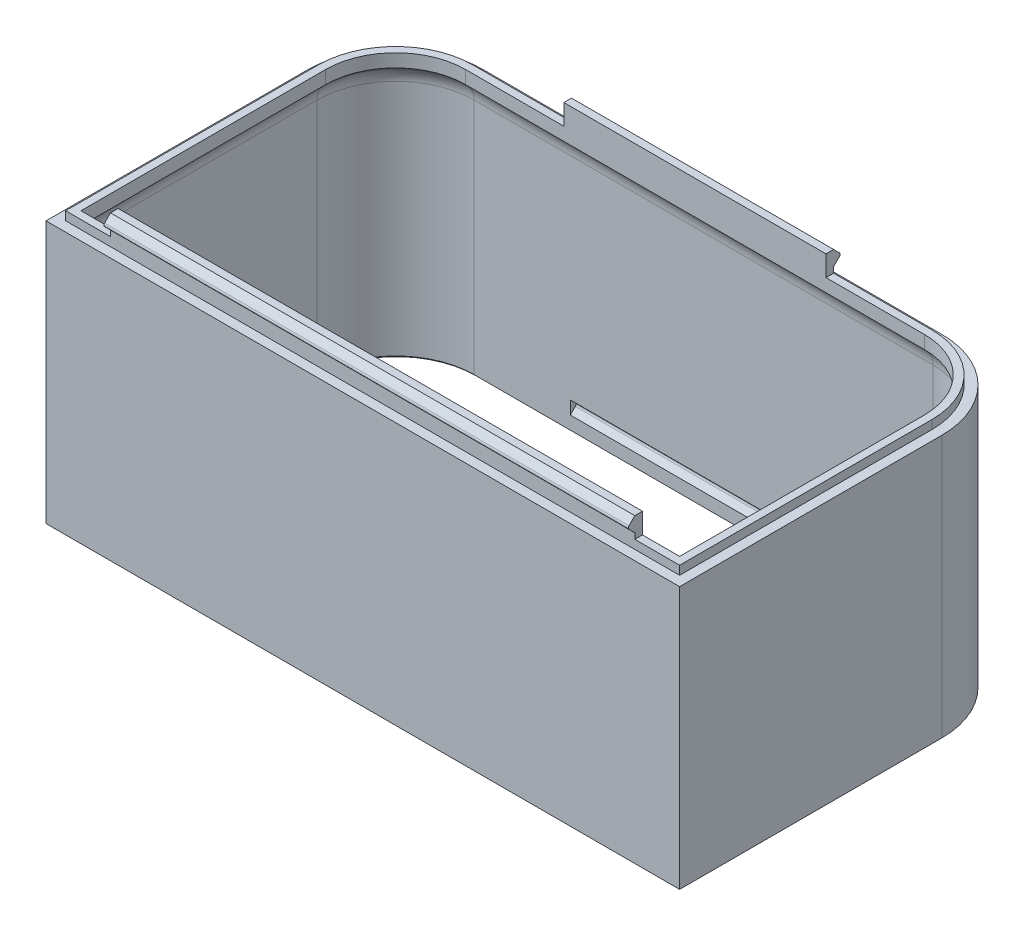
from build123d import *

# Parameters (mm, degrees)
EXTRUDE_1_DEPTH     = 60
EXTRUDE_START       = -1
EXTRUDE_2_DEPTH     = 1
CHAMFER_3_SIZE      = 2
EXTRUDE_8_DEPTH     = 2
EXTRUDE_9_DEPTH     = 30
EXTRUDE_10_DEPTH    = 60
CUT_EXTRUDE_2_DEPTH = 60.5
CUT_EXTRUDE_3_DEPTH = 30.5
CHAMFER_6_SIZE      = 0.5
FILLET_3_R          = 5
FILLET_4_R          = 0.5
FILLET_5_R          = 0.5


with BuildPart() as part:
    # Эскиз1 → Бобышка-Вытянуть1 (new body)
    with BuildSketch(Plane(origin=(0, 0, 0), x_dir=(1, 0, 0), z_dir=(0, 1, 0))):
        with BuildLine():
            Line((-72.5, 0), (72.5, 0))
            Line((72.5, 0), (72.5, 60))
            ThreePointArc((72.5, 60), (66.642135624, 74.142135624), (52.5, 80))
            Line((52.5, 80), (-52.5, 80))
            ThreePointArc((-52.5, 80), (-66.642135624, 74.142135624), (-72.5, 60))
            Line((-72.5, 60), (-72.5, 0))
        make_face()
        with BuildLine():
            Line((-70.5, 2), (70.5, 2))
            Line((70.5, 2), (70.5, 60))
            ThreePointArc((70.5, 60), (65.227922061, 72.727922061), (52.5, 78))
            Line((52.5, 78), (-52.5, 78))
            ThreePointArc((-52.5, 78), (-65.227922061, 72.727922061), (-70.5, 60))
            Line((-70.5, 60), (-70.5, 2))
        make_face(mode=Mode.SUBTRACT)
    extrude(amount=EXTRUDE_1_DEPTH)

    # Эскиз2 → Бобышка-Вытянуть2 (add)
    with BuildSketch(Plane(origin=(0, 60, 0), x_dir=(1, 0, 0), z_dir=(0, 1, 0)).offset(EXTRUDE_START)):
        with BuildLine():
            Line((-72.5, 60), (-72.5, 0))
            Line((-72.5, 0), (72.5, 0))
            Line((72.5, 0), (72.5, 60))
            ThreePointArc((72.5, 60), (66.642135624, 74.142135624), (52.5, 80))
            Line((52.5, 80), (-52.5, 80))
            ThreePointArc((-52.5, 80), (-66.642135624, 74.142135624), (-72.5, 60))
        make_face()
        with BuildLine():
            Line((-68.5, 60), (-68.5, 4))
            Line((-68.5, 4), (68.5, 4))
            Line((68.5, 4), (68.5, 60))
            ThreePointArc((68.5, 60), (63.813708499, 71.313708499), (52.5, 76))
            Line((52.5, 76), (-52.5, 76))
            ThreePointArc((-52.5, 76), (-63.813708499, 71.313708499), (-68.5, 60))
        make_face(mode=Mode.SUBTRACT)
    extrude(amount=EXTRUDE_2_DEPTH)

    # Фаска3
    chamfer_3_edges = [part.edges().sort_by_distance(p)[0] for p in [
        (-65.227922061, 59, -72.727922061),
        (-70.5, 59, -31),
        (0, 59, -2),
        (70.5, 59, -31),
        (65.227922061, 59, -72.727922061),
        (0, 59, -78),
    ]]
    chamfer(chamfer_3_edges, length=CHAMFER_3_SIZE - 0.0001)  # a hair under: the kernel refuses the full size

    # Эскиз11 → Бобышка-Вытянуть8 (add)
    with BuildSketch(Plane(origin=(0, 60, 0), x_dir=(1, 0, 0), z_dir=(0, 1, 0))):
        with BuildLine():
            Line((70.25, 2.25), (70.25, 60))
            ThreePointArc((70.25, 60), (65.051145366, 72.551145366), (52.5, 77.75))
            Line((52.5, 77.75), (-52.5, 77.75))
            ThreePointArc((-52.5, 77.75), (-65.051145366, 72.551145366), (-70.25, 60))
            Line((-70.25, 60), (-70.25, 2.25))
            Line((-70.25, 2.25), (70.25, 2.25))
        make_face()
        with BuildLine():
            Line((68.5, 4), (68.5, 60))
            ThreePointArc((68.5, 60), (63.813708499, 71.313708499), (52.5, 76))
            Line((52.5, 76), (-52.5, 76))
            ThreePointArc((-52.5, 76), (-63.813708499, 71.313708499), (-68.5, 60))
            Line((-68.5, 60), (-68.5, 4))
            Line((-68.5, 4), (68.5, 4))
        make_face(mode=Mode.SUBTRACT)
    extrude(amount=EXTRUDE_8_DEPTH)

    # Эскиз12 → Бобышка-Вытянуть9 (add, symmetric)
    with BuildSketch(Plane(origin=(0, 0, 0), x_dir=(0, 0, -1), z_dir=(1, 0, 0))):
        Polygon((76, 62), (76, 66.7), (77.75, 66.7), (79.45, 65), (77.75, 63.3), (77.75, 62), align=None)
    extrude(amount=EXTRUDE_9_DEPTH, both=True)

    # Эскиз13 → Бобышка-Вытянуть10 (add, symmetric)
    with BuildSketch(Plane(origin=(0, 0, 0), x_dir=(0, 0, -1), z_dir=(1, 0, 0))):
        Polygon((2.25, 62), (2.25, 63.3), (0.55, 65), (2.25, 66.7), (4, 66.7), (4, 62), align=None)
    extrude(amount=EXTRUDE_10_DEPTH, both=True)

    # Эскиз15 → Вырез-Вытянуть2 (cut, symmetric)
    with BuildSketch(Plane(origin=(0, 0, 0), x_dir=(0, 0, -1), z_dir=(1, 0, 0))):
        Polygon((2, 3.5), (2, 6.5), (0.5, 5), align=None)
    extrude(amount=CUT_EXTRUDE_2_DEPTH, both=True, mode=Mode.SUBTRACT)

    # Эскиз16 → Вырез-Вытянуть3 (cut, symmetric)
    with BuildSketch(Plane(origin=(0, 0, 0), x_dir=(0, 0, -1), z_dir=(1, 0, 0))):
        Polygon((78, 3.5), (78, 6.5), (79.5, 5), align=None)
    extrude(amount=CUT_EXTRUDE_3_DEPTH, both=True, mode=Mode.SUBTRACT)

    # Фаска6
    chamfer_6_edges = [part.edges().sort_by_distance(p)[0] for p in [
        (-70.5, 0, -31),
        (0, 0, -2),
        (70.5, 0, -31),
        (65.227922061, 0, -72.727922061),
        (0, 0, -78),
        (-65.227922061, 0, -72.727922061),
    ]]
    chamfer(chamfer_6_edges, length=CHAMFER_6_SIZE)

    # Скругление3
    fillet_3_edges = [part.edges().sort_by_distance(p)[0] for p in [
        (70.5, 57.0001, -31),
        (65.227922061, 57.0001, -72.727922061),
        (0, 57.0001, -78),
        (-65.227922061, 57.0001, -72.727922061),
        (0, 57.0001, -2),
        (-70.5, 57.0001, -31),
    ]]
    fillet(fillet_3_edges, radius=FILLET_3_R)

    # Скругление4
    fillet_4_edges = [part.edges().sort_by_distance(p)[0] for p in [
        (0, 5, -0.5),
        (0, 5, -79.5),
    ]]
    fillet(fillet_4_edges, radius=FILLET_4_R)

    # Скругление5
    fillet_5_edges = [part.edges().sort_by_distance(p)[0] for p in [
        (0, 65, -79.45),
        (0, 65, -0.55),
    ]]
    fillet(fillet_5_edges, radius=FILLET_5_R)


solid = part.part
